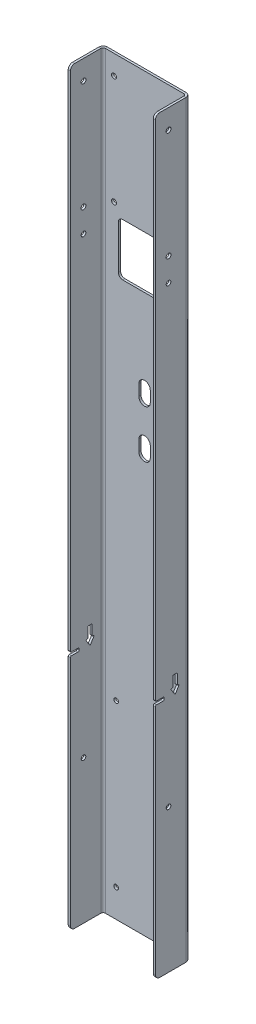
from build123d import *

# Parameters (mm, degrees)
BASE_FLANGE1_DEPTH          = 1103.3125
SKETCH29_W                  = 76.2
SKETCH29_H                  = 76.2
CUT_EXTRUDE1_DEPTH          = 25.4
F_1_4_CLEARANCE_HOLE5_D     = 6.7564
F_1_4_CLEARANCE_HOLE2_D     = 7.14248
F_1_4_CLEARANCE_HOLE3_D     = 7.14248
F_1_4_CLEARANCE_HOLE4_D     = 6.7564
F_1_2_START                 = -50.8
F_1_2_CLEARANCE_SLOT1_DEPTH = 3.175
SKETCH53_W                  = 50.8
SKETCH53_H                  = 12.7
CUT_EXTRUDE2_DEPTH          = 1112.759017349
TOP_FLANGE_FILLET_R         = 6.35
INTERIOR_CUT_FILLET_R       = 6.35
BOTTOM_EDGE_FILLET_R        = 6.35
SKETCH54_W                  = 12.7
SKETCH54_H                  = 4.7625
CUT_EXTRUDE3_DEPTH          = 1112.759017349
FILLET1_R                   = 0.79375
FILLET2_R                   = 1.5875


# Read off the part's stored shape, not the designer's step: 1/2 Clearance Slot1
# Sheet-metal steps are written as plain solids
with BuildPart() as part:
    # Sketch1 → Base-Flange1 (new body)
    with BuildSketch(Plane(origin=(0, 0, 0), x_dir=(1, 0, 0), z_dir=(0, 1, 0))):
        with BuildLine():
            Line((0, 0), (0, 44.45))
            ThreePointArc((0, 44.45), (1.859871939, 48.940128061), (6.35, 50.8))
            Line((6.35, 50.8), (120.65, 50.8))
            ThreePointArc((120.65, 50.8), (125.140128061, 48.940128061), (127, 44.45))
            Line((127, 44.45), (127, 0))
            Line((127, 0), (123.825, 0))
            Line((123.825, 0), (123.825, 44.45))
            ThreePointArc((123.825, 44.45), (122.89506403, 46.69506403), (120.65, 47.625))
            Line((120.65, 47.625), (6.35, 47.625))
            ThreePointArc((6.35, 47.625), (4.10493597, 46.69506403), (3.175, 44.45))
            Line((3.175, 44.45), (3.175, 0))
            Line((3.175, 0), (0, 0))
        make_face()
    extrude(amount=BASE_FLANGE1_DEPTH)

    # Sketch29 → Cut-Extrude1 (cut)
    with BuildSketch(Plane(origin=(0, 0, -50.8), x_dir=(-1, 0, 0), z_dir=(0, 0, -1))):
        with Locations((-63.5, 862.0125)):
            Rectangle(SKETCH29_W, SKETCH29_H)
    extrude(amount=-CUT_EXTRUDE1_DEPTH, mode=Mode.SUBTRACT)

    # 1/4 Clearance Hole5 (through all)
    with Locations(Plane(origin=(0, 0, -50.8), x_dir=(-1, 0, 0), z_dir=(0, 0, -1))):
        with Locations((-104.775, 53.61305), (-104.775, 288.56305), (-22.225, 288.56305), (-22.225, 53.61305)):
            Hole(F_1_4_CLEARANCE_HOLE5_D / 2)

    # 1/4 Clearance Hole2 (through all)
    with Locations(Plane(origin=(127, 0, 0), x_dir=(0, 0, -1), z_dir=(1, 0, 0))):
        with Locations((19.05, 1074.7375), (19.05, 915.9875)):
            Hole(F_1_4_CLEARANCE_HOLE2_D / 2)

    # 1/4 Clearance Hole3 (through all)
    with Locations(Plane(origin=(0, 0, -50.8), x_dir=(-1, 0, 0), z_dir=(0, 0, -1))):
        with Locations((-107.95, 1074.7375), (-19.05, 1074.7375), (-19.05, 915.9875), (-107.95, 915.9875)):
            Hole(F_1_4_CLEARANCE_HOLE3_D / 2)

    # 1/4 Clearance Hole4 (through all)
    with Locations(Plane(origin=(127, 0, 0), x_dir=(0, 0, -1), z_dir=(1, 0, 0))):
        with Locations((19.05, 221.45625), (19.05, 881.85625)):
            Hole(F_1_4_CLEARANCE_HOLE4_D / 2)

    # 1/2 Clearance Slot1 outline → 1/2 Clearance Slot1 (cut)
    with BuildSketch(Plane.XY.offset(F_1_2_START)):
        with BuildLine():
            Line((71.834375, 619.125), (71.834375, 635))
            ThreePointArc((71.834375, 635), (63.5, 643.334375), (55.165625, 635))
            Line((55.165625, 635), (55.165625, 619.125))
            ThreePointArc((55.165625, 619.125), (63.5, 610.790625), (71.834375, 619.125))
        make_face()
        with BuildLine():
            Line((71.834375, 688.975), (71.834375, 704.85))
            ThreePointArc((71.834375, 704.85), (63.5, 713.184375), (55.165625, 704.85))
            Line((55.165625, 704.85), (55.165625, 688.975))
            ThreePointArc((55.165625, 688.975), (63.5, 680.640625), (71.834375, 688.975))
        make_face()
    extrude(amount=F_1_2_CLEARANCE_SLOT1_DEPTH, mode=Mode.SUBTRACT)

    # Sketch53 → Cut-Extrude2 (cut, through all)
    with BuildSketch(Plane.ZY):
        with Locations((-25.4, 6.35)):
            Rectangle(SKETCH53_W, SKETCH53_H)
    extrude(amount=-CUT_EXTRUDE2_DEPTH, mode=Mode.SUBTRACT)

    # top flange fillet
    top_flange_fillet_edges = [part.edges().sort_by_distance(p)[0] for p in [
        (125.4125, 12.7, 0),
        (1.5875, 12.7, 0),
    ]]
    fillet(top_flange_fillet_edges, radius=TOP_FLANGE_FILLET_R)

    # interior cut fillet
    interior_cut_fillet_edges = [part.edges().sort_by_distance(p)[0] for p in [
        (25.4, 900.1125, -49.2125),
        (25.4, 823.9125, -49.2125),
        (101.6, 823.9125, -49.2125),
        (101.6, 900.1125, -49.2125),
    ]]
    fillet(interior_cut_fillet_edges, radius=INTERIOR_CUT_FILLET_R)

    # bottom edge fillet
    bottom_edge_fillet_edges = [part.edges().sort_by_distance(p)[0] for p in [
        (1.5875, 1103.3125, 0),
        (125.4125, 1103.3125, 0),
    ]]
    fillet(bottom_edge_fillet_edges, radius=BOTTOM_EDGE_FILLET_R)

    # Sketch54 → Cut-Extrude3 (cut, through all)
    with BuildSketch(Plane(origin=(127, 0, 0), x_dir=(0, 0, -1), z_dir=(1, 0, 0))):
        with Locations((6.35, 361.15625)):
            Rectangle(SKETCH54_W, SKETCH54_H)
        Polygon((28.575, 358.06292713), (34.925, 368.3), (31.75, 368.3), (31.75, 384.175), (25.4, 384.175), (25.4, 368.3), (22.225, 368.3), align=None)
    extrude(amount=-CUT_EXTRUDE3_DEPTH, mode=Mode.SUBTRACT)

    # Fillet1
    fillet1_edges = [part.edges().sort_by_distance(p)[0] for p in [
        (125.4125, 358.06292713, -28.575),
        (1.5875, 358.06292713, -28.575),
        (125.4125, 368.3, -22.225),
        (1.5875, 368.3, -22.225),
        (125.4125, 368.3, -25.4),
        (1.5875, 368.3, -25.4),
        (125.4125, 384.175, -25.4),
        (1.5875, 384.175, -25.4),
        (125.4125, 384.175, -31.75),
        (1.5875, 384.175, -31.75),
        (125.4125, 368.3, -31.75),
        (1.5875, 368.3, -31.75),
        (125.4125, 368.3, -34.925),
        (1.5875, 368.3, -34.925),
    ]]
    fillet(fillet1_edges, radius=FILLET1_R)

    # Fillet2
    fillet2_edges = [part.edges().sort_by_distance(p)[0] for p in [
        (125.4125, 358.775, 0),
        (1.5875, 358.775, 0),
        (125.4125, 363.5375, 0),
        (1.5875, 363.5375, 0),
        (125.4125, 363.5375, -12.7),
        (1.5875, 363.5375, -12.7),
        (125.4125, 358.775, -12.7),
        (1.5875, 358.775, -12.7),
    ]]
    fillet(fillet2_edges, radius=FILLET2_R)


solid = part.part
